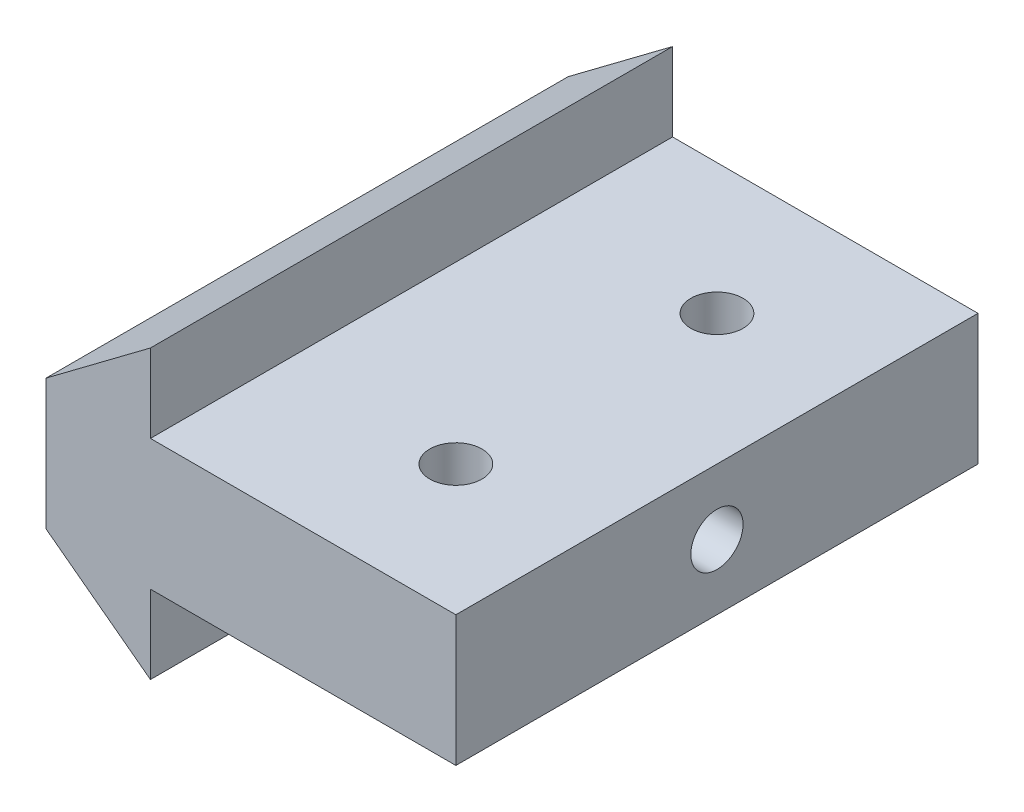
from build123d import *

# Parameters (mm, degrees)
BOSS_EXTRU_1_DEPTH      = 20
ESQUISSE3_R             = 1
ENL_V_MAT_EXTRU_2_DEPTH = 27.655018289
ESQUISSE4_R             = 1
ENL_V_MAT_EXTRU_3_DEPTH = 27.655018289


with BuildPart() as part:
    # ProfileRainureEsquisse → Boss.-Extru.1 (new body)
    with BuildSketch(Plane.XY):
        Polygon((0, 0), (0, 5), (4, 8), (4, 5), (15.7, 5), (15.7, 0), (4, 0), (4, -3), align=None)
    extrude(amount=BOSS_EXTRU_1_DEPTH)

    # Esquisse3 → Enlèv. mat.-Extru.2 (cut, through all)
    with BuildSketch(Plane.XZ):
        with Locations((10.7, 15)):
            Circle(ESQUISSE3_R)
        with Locations((10.7, 5)):
            Circle(ESQUISSE3_R)
    extrude(amount=-ENL_V_MAT_EXTRU_2_DEPTH, mode=Mode.SUBTRACT)

    # Esquisse4 → Enlèv. mat.-Extru.3 (cut, through all)
    with BuildSketch(Plane(origin=(15.7, 0, 0), x_dir=(0, 0, -1), z_dir=(1, 0, 0))):
        with Locations((-10, 2.5)):
            Circle(ESQUISSE4_R)
    extrude(amount=-ENL_V_MAT_EXTRU_3_DEPTH, mode=Mode.SUBTRACT)


solid = part.part
